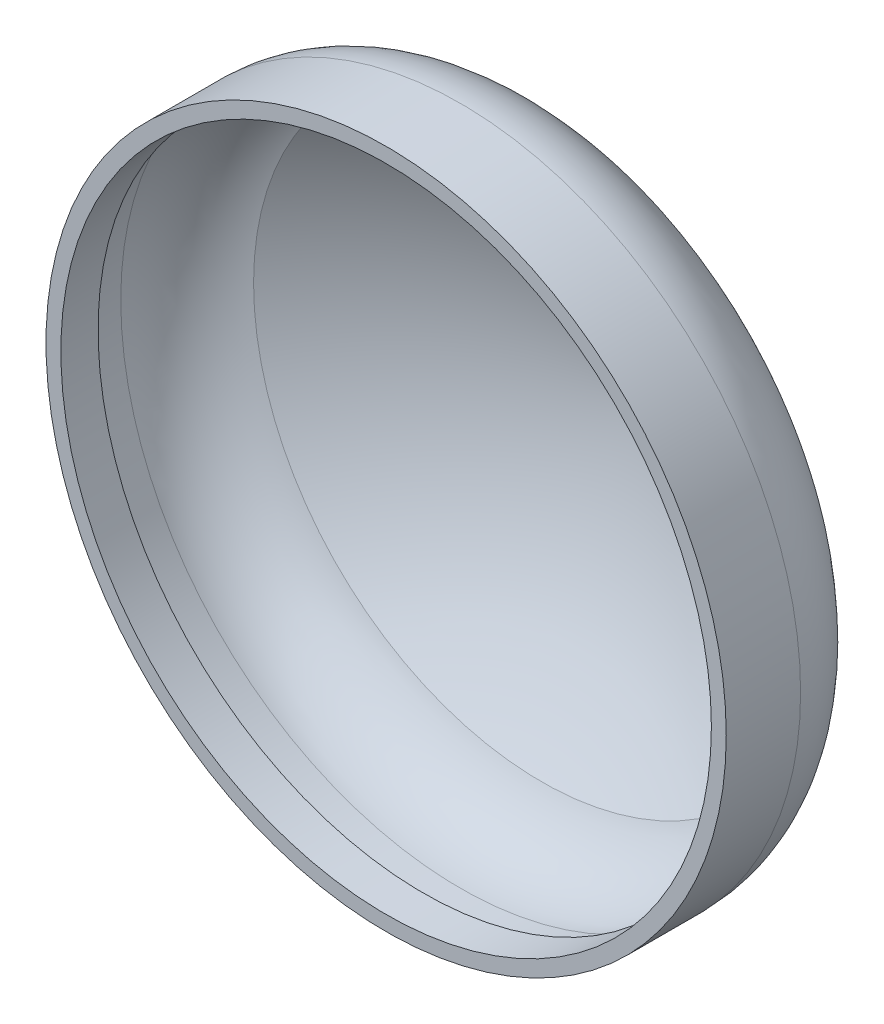
from build123d import *

# Parameters (mm, degrees)
SKETCH1_R           = 464.82
SKETCH1_R_2         = 444.5
BOSS_EXTRUDE1_DEPTH = 50.8


# Read off the part's stored shape, not the designer's step: Shell5
with BuildPart() as part:
    # Sketch1 → Boss-Extrude1 (new body)
    with BuildSketch(Plane.XY):
        Circle(SKETCH1_R)
        Circle(SKETCH1_R_2, mode=Mode.SUBTRACT)
    extrude(amount=BOSS_EXTRUDE1_DEPTH)

    # Sketch2 → Revolve1 (revolve)
    with BuildSketch(Plane(origin=(0, 0, 0), x_dir=(0, 0, -1), z_dir=(1, 0, 0)), mode=Mode.PRIVATE) as revolve1_sk:
        with BuildLine():
            Line((0, 0), (304.8, 0))
            ThreePointArc((304.8, 0), (261.388370789, -207.061888688), (162.113606977, -393.887252512))
            ThreePointArc((162.113606977, -393.887252512), (116.79654113, -445.57960837), (50.8, -464.82))
            Line((50.8, -464.82), (0, -464.82))
            Line((0, -464.82), (0, 0))
        make_face()
    revolve(revolve1_sk.sketch.rotate(Axis((0, 0, 0), (0, 0, -1)), 270), axis=Axis((0, 0, 0), (0, 0, -1)))

    # Shell5 outline → Shell5 (revolve, cut)
    with BuildSketch(Plane.XZ):
        with BuildLine():
            add(Edge.make_bspline(
                [(0, -304.239988079), (217.442850694, -289.906024153), (393.602166776, -161.629950012)],
                knots=[4.778214345, 4.778214345, 4.778214345, 5.341779838, 5.341779838, 5.341779838], degree=2, weights=[1, 0.960561239, 1]))
            ThreePointArc((393.602166776, -161.629950012), (445.093816183, -116.519055068), (464.2612, -50.8))
            Line((464.2612, -50.8), (464.2612, 50.2412))
            Line((464.2612, 50.2412), (445.0588, 50.2412))
            Line((445.0588, 50.2412), (445.0588, 0))
            Line((445.0588, 0), (0, 0))
            Line((0, 0), (0, -304.239988079))
        make_face()
    revolve(axis=Axis((0, 0, 0), (0, 0, 1)), mode=Mode.SUBTRACT)


solid = part.part
